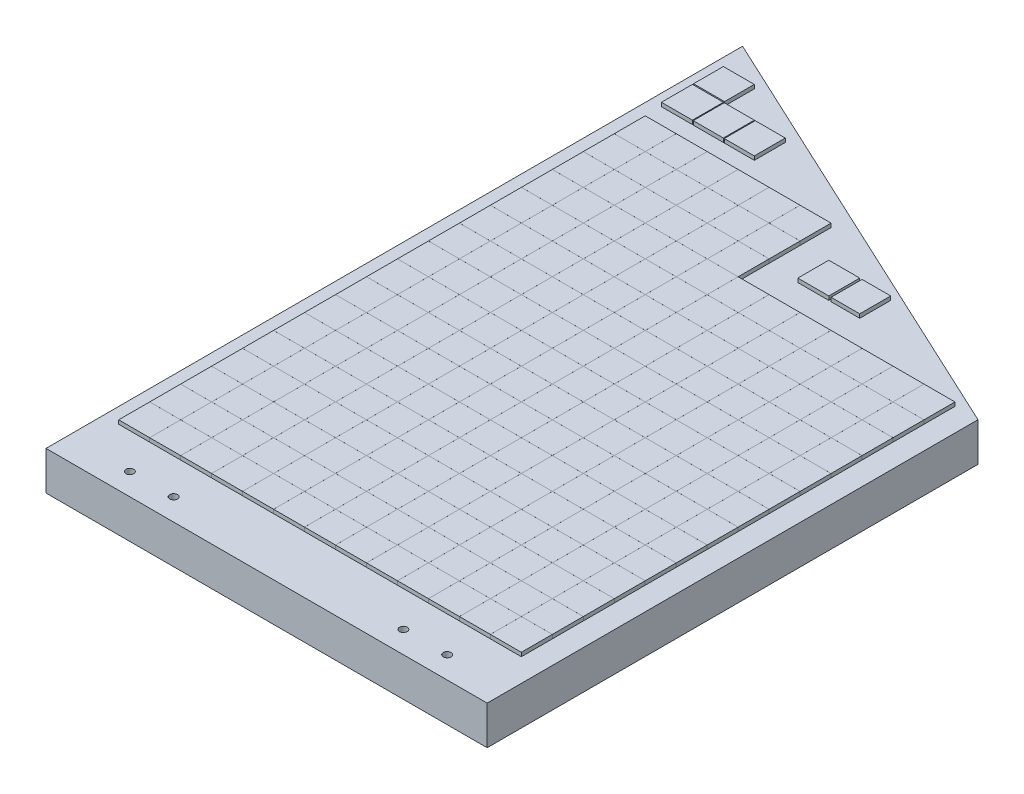
from build123d import *

# Parameters (mm, degrees)
BOSS_EXTRUDE1_DEPTH  = 63.5
SKETCH2_R            = 6.35
CUT_EXTRUDE1_DEPTH   = 1210.817492968
SKETCH3_W            = 50.8
SKETCH3_H            = 50.8
BOSS_EXTRUDE2_DEPTH  = 6.35
LPATTERN1_COUNT      = 14
LPATTERN1_PITCH      = 50.8254
LPATTERN1_COUNT_DIR2 = 13
LPATTERN1_PITCH_DIR2 = 50.8254
LPATTERN2_COUNT      = 4
LPATTERN2_PITCH      = 50.8254
LPATTERN2_COUNT_DIR2 = 6
LPATTERN2_PITCH_DIR2 = 50.8254
SKETCH6_W            = 50.8
SKETCH6_H            = 48.86293595
SKETCH6_H_2          = 50.8
SKETCH6_W_2          = 49.363241493
SKETCH6_W_3          = 49.289327479
BOSS_EXTRUDE8_DEPTH  = 6.35
SKETCH7_W            = 50.8
SKETCH7_H            = 50.8
SKETCH7_W_2          = 47.025980167
BOSS_EXTRUDE9_DEPTH  = 6.35


with BuildPart() as part:
    # Sketch1 → Boss-Extrude1 (new body)
    with BuildSketch(Plane(origin=(0, 0, 0), x_dir=(1, 0, 0), z_dir=(0, 1, 0))):
        Polygon((-332.521517848, 0), (391.378482152, 0), (391.378482152, 805.439886262), (-332.521517848, 1143), align=None)
    extrude(amount=BOSS_EXTRUDE1_DEPTH)

    # Sketch2 → Cut-Extrude1 (cut, through all)
    with BuildSketch(Plane(origin=(0, 63.5, 0), x_dir=(1, 0, 0), z_dir=(0, 1, 0))):
        with Locations((-230.921517848, 35.941)):
            Circle(SKETCH2_R)
        with Locations((-159.039517848, 35.941)):
            Circle(SKETCH2_R)
        with Locations((217.896482152, 35.941)):
            Circle(SKETCH2_R)
        with Locations((289.778482152, 35.941)):
            Circle(SKETCH2_R)
    extrude(amount=-CUT_EXTRUDE1_DEPTH, mode=Mode.SUBTRACT)

    # Sketch3 → Boss-Extrude2 (add)
    with BuildSketch(Plane(origin=(0, 63.5, 0), x_dir=(1, 0, 0), z_dir=(0, 1, 0))):
        with Locations((-281.721517848, 780.039886262)):
            Rectangle(SKETCH3_W, SKETCH3_H)
    boss_extrude2 = extrude(amount=BOSS_EXTRUDE2_DEPTH)

    # LPattern1: Boss-Extrude2 14 × 13
    with Locations(*[(j * LPATTERN1_PITCH_DIR2, 0, i * LPATTERN1_PITCH) for i in range(LPATTERN1_COUNT) for j in range(LPATTERN1_COUNT_DIR2) if (i, j) != (0, 0)]):
        add(boss_extrude2)

    # LPattern2: Boss-Extrude2 4 × 6
    with Locations(*[(j * LPATTERN2_PITCH_DIR2, 0, -i * LPATTERN2_PITCH) for i in range(LPATTERN2_COUNT) for j in range(LPATTERN2_COUNT_DIR2) if (i, j) != (0, 0)]):
        add(boss_extrude2)

    # Sketch6 → Boss-Extrude8 (add)
    with BuildSketch(Plane(origin=(0, 63.5, 0), x_dir=(1, 0, 0), z_dir=(0, 1, 0))):
        with Locations((-287.691293956, 1067.629644097)):
            Rectangle(SKETCH6_W, SKETCH6_H)
        with Locations((-287.691293956, 1015.861112072)):
            Rectangle(SKETCH6_W, SKETCH6_H_2)
        with Locations((-236.172914703, 1015.861112072)):
            Rectangle(SKETCH6_W_2, SKETCH6_H_2)
        with Locations((-185.335957696, 1015.861112072)):
            Rectangle(SKETCH6_W_3, SKETCH6_H_2)
    extrude(amount=BOSS_EXTRUDE8_DEPTH)

    # Sketch7 → Boss-Extrude9 (add)
    with BuildSketch(Plane(origin=(0, 63.5, 0), x_dir=(1, 0, 0), z_dir=(0, 1, 0))):
        with Locations((74.030882152, 877.932213531)):
            Rectangle(SKETCH7_W, SKETCH7_H)
        with Locations((126.717892069, 877.932213531)):
            Rectangle(SKETCH7_W_2, SKETCH7_H)
    extrude(amount=BOSS_EXTRUDE9_DEPTH)


solid = part.part
